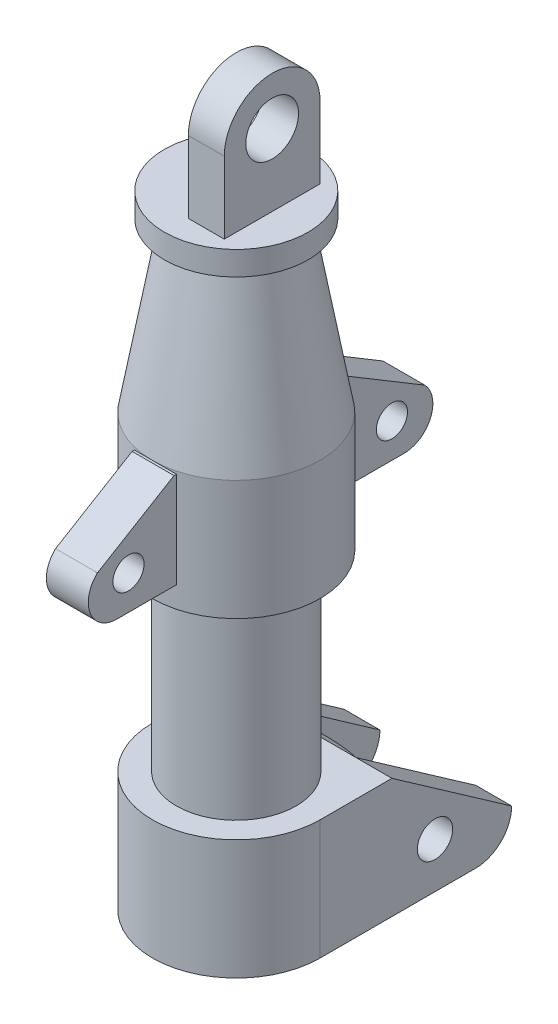
from build123d import *

# Parameters (mm, degrees)
SKETCH1_R                = 20
BOSS_EXTRUDE1_DEPTH      = 117.5
SKETCH2_R                = 35
BOSS_EXTRUDE2_DEPTH      = 50
SKETCH3_R                = 25
BOSS_EXTRUDE3_DEPTH      = 235
SKETCH1_3_R              = 20
CUT_EXTRUDE1_DEPTH       = 117.5
BOSS_EXTRUDE4_DEPTH      = 35
CUT_EXTRUDE2_DEPTH       = 80
BOSS_EXTRUDE5_START      = -50
BOSS_EXTRUDE5_DEPTH      = 50
BOSS_EXTRUDE6_START      = -50
BOSS_EXTRUDE6_DEPTH      = 50
CUT_EXTRUDE5_DEPTH       = 205.572725455
SKETCH12_R               = 7.371760232
CUT_EXTRUDE6_DEPTH       = 159.449518775
BOSS_EXTRUDE9_START      = -105
SKETCH16_R               = 35
BOSS_EXTRUDE9_DEPTH      = 105
CUT_EXTRUDE9_START       = -55
SKETCH18_R               = 35
CUT_EXTRUDE9_DEPTH       = 55
BOSS_EXTRUDE10_START     = 55
SKETCH19_R               = 25
BOSS_EXTRUDE10_DEPTH     = 55
SKETCH20_R               = 20
CUT_EXTRUDE10_DEPTH      = 251.699022734
SKETCH57_R               = 30
BOSS_EXTRUDE11_DEPTH     = 10
BOSS_EXTRUDE13_DEPTH     = 15
SKETCH59_R               = 11
CUT_EXTRUDE11_DEPTH      = 215.374088919
BOSS_EXTRUDE20_DEPTH     = 42.5
BOSS_EXTRUDE21_DEPTH     = 42.5
CUT_EXTRUDE12_DEPTH      = 25
CUT_EXTRUDE18_START      = -25
CUT_EXTRUDE18_DEPTH      = 25
SKETCH71_W               = 21.239894534
SKETCH71_H               = 33.551769162
CUT_EXTRUDE19_DEPTH      = 25
CUT_EXTRUDE20_DEPTH      = 214.26333487
CUT_EXTRUDE20_DEPTH_BACK = 214.26333487
SKETCH72_R               = 6.5


# Read off the part's stored shape, not the designer's step: Cut-Extrude18
with BuildPart() as part:
    # Sketch1 → Boss-Extrude1 (new, symmetric)
    with BuildSketch(Plane(origin=(0, 0, 0), x_dir=(1, 0, 0), z_dir=(0, 1, 0))):
        with Locations(Location((0, 0, 0), (0, 0, 90))):
            Circle(SKETCH1_R)
    extrude(amount=BOSS_EXTRUDE1_DEPTH, both=True)

    # Sketch2 → Boss-Extrude2 (add)
    with BuildSketch(Plane.XZ.offset(117.5)):
        with Locations(Location((0, 0, 0), (0, 0, 270))):
            Circle(SKETCH2_R)
    extrude(amount=-BOSS_EXTRUDE2_DEPTH)

    # Sketch3 → Boss-Extrude3 (add)
    with BuildSketch(Plane(origin=(0, 117.5, 0), x_dir=(1, 0, 0), z_dir=(0, 1, 0))):
        with Locations(Location((0, 0, 0), (0, 0, 270))):
            Circle(SKETCH3_R)
    extrude(amount=-BOSS_EXTRUDE3_DEPTH)

    # Sketch1<3> → Cut-Extrude1 (cut, symmetric)
    with BuildSketch(Plane(origin=(0, 0, 0), x_dir=(1, 0, 0), z_dir=(0, 1, 0))):
        with Locations(Location((0, 0, 0), (0, 0, 270))):
            Circle(SKETCH1_3_R)
    extrude(amount=CUT_EXTRUDE1_DEPTH, both=True, mode=Mode.SUBTRACT)

    # Sketch4 → Boss-Extrude4 (add, symmetric)
    with BuildSketch(Plane(origin=(0, 0, 0), x_dir=(0, 0, -1), z_dir=(1, 0, 0))):
        with BuildLine():
            Line((30.014819764, -67.5), (30.014819764, -117.5))
            Line((30.014819764, -117.5), (65, -117.5))
            ThreePointArc((65, -117.5), (75.606601718, -113.106601718), (80, -102.5))
            Line((80, -102.5), (30.014819764, -67.5))
        make_face()
    extrude(amount=BOSS_EXTRUDE4_DEPTH, both=True)

    # Sketch5 → Cut-Extrude2 (cut)
    with BuildSketch(Plane(origin=(35, 0, 0), x_dir=(0, 0, -1), z_dir=(1, 0, 0))):
        Polygon((30.014819764, -67.5), (35, -67.5), (35, -70.990660781), align=None)
    extrude(amount=-CUT_EXTRUDE2_DEPTH, mode=Mode.SUBTRACT)

    # Sketch6 → Boss-Extrude5 (add)
    with BuildSketch(Plane(origin=(0, -67.5, 0), x_dir=(1, 0, 0), z_dir=(0, 1, 0)).offset(BOSS_EXTRUDE5_START)):
        with BuildLine():
            Line((-35, 30.014819764), (-35, 0))
            ThreePointArc((-35, 0), (-30.455767215, 17.246629913), (-18.003071808, 30.014819764))
            Line((-18.003071808, 30.014819764), (-35, 30.014819764))
        make_face()
    extrude(amount=BOSS_EXTRUDE5_DEPTH)

    # Sketch7 → Boss-Extrude6 (add)
    with BuildSketch(Plane(origin=(0, -67.5, 0), x_dir=(1, 0, 0), z_dir=(0, 1, 0)).offset(BOSS_EXTRUDE6_START)):
        with BuildLine():
            Line((35, 30.014819764), (35, 0))
            ThreePointArc((35, 0), (30.455767215, 17.246629913), (18.003071808, 30.014819764))
            Line((18.003071808, 30.014819764), (35, 30.014819764))
        make_face()
    extrude(amount=BOSS_EXTRUDE6_DEPTH)

    # Sketch9 → Cut-Extrude5 (cut, through all)
    with BuildSketch(Plane(origin=(0, -67.5, 0), x_dir=(1, 0, 0), z_dir=(0, 1, 0))):
        with BuildLine():
            Line((0, 80), (-20, 80))
            Line((-20, 80), (-20, 30.014819764))
            ThreePointArc((-20, 30.014819764), (0, 35.08744218), (20, 30.014819764))
            Line((20, 30.014819764), (20, 80))
            Line((20, 80), (0, 80))
        make_face()
    extrude(amount=-CUT_EXTRUDE5_DEPTH, mode=Mode.SUBTRACT)

    # Sketch12 → Cut-Extrude6 (cut, through all)
    with BuildSketch(Plane(origin=(35, 0, 0), x_dir=(0, 0, -1), z_dir=(1, 0, 0))):
        with Locations((48, -98.5)):
            Circle(SKETCH12_R)
    extrude(amount=-CUT_EXTRUDE6_DEPTH, mode=Mode.SUBTRACT)

    # Sketch16 → Boss-Extrude9 (add)
    with BuildSketch(Plane(origin=(0, 117.5, 0), x_dir=(1, 0, 0), z_dir=(0, 1, 0)).offset(BOSS_EXTRUDE9_START)):
        with Locations(Location((0, 0, 0), (0, 0, 270))):
            Circle(SKETCH16_R)
    extrude(amount=BOSS_EXTRUDE9_DEPTH)

    # Sketch18 → Cut-Extrude9 (cut)
    with BuildSketch(Plane(origin=(0, 117.5, 0), x_dir=(1, 0, 0), z_dir=(0, 1, 0)).offset(CUT_EXTRUDE9_START)):
        with Locations(Location((0, 0, 0), (0, 0, 270))):
            Circle(SKETCH18_R)
    extrude(amount=CUT_EXTRUDE9_DEPTH, mode=Mode.SUBTRACT)

    # Sketch19 → Boss-Extrude10 (add)
    with BuildSketch(Plane(origin=(0, 62.5, 0), x_dir=(1, 0, 0), z_dir=(0, 1, 0)).offset(BOSS_EXTRUDE10_START)):
        with Locations(Location((0, 0, 0), (0, 0, 270))):
            Circle(SKETCH19_R)
    extrude(amount=-BOSS_EXTRUDE10_DEPTH)

    # Sketch20 → Cut-Extrude10 (cut, through all)
    with BuildSketch(Plane(origin=(0, 117.5, 0), x_dir=(1, 0, 0), z_dir=(0, 1, 0))):
        with Locations(Location((0, 0, 0), (0, 0, 270))):
            Circle(SKETCH20_R)
    extrude(amount=-CUT_EXTRUDE10_DEPTH, mode=Mode.SUBTRACT)

    # Sketch21 → Revolve1 (revolve)
    with BuildSketch(Plane(origin=(0, 0, 0), x_dir=(0, 0, -1), z_dir=(1, 0, 0))):
        Polygon((-35, 62.5), (-22.65711135, 132.5), (0, 132.5), (0, 62.5), align=None)
    revolve(axis=Axis((0, 132.5, 0), (0, -1, 0)))

    # Sketch57 → Boss-Extrude11 (add)
    with BuildSketch(Plane(origin=(0, 132.5, 0), x_dir=(1, 0, 0), z_dir=(0, 1, 0))):
        with Locations(Location((0, 0, 0), (0, 0, 270))):
            Circle(SKETCH57_R)
    extrude(amount=BOSS_EXTRUDE11_DEPTH)

    # Sketch58 → Boss-Extrude13 (add)
    with BuildSketch(Plane(origin=(0, 0, 0), x_dir=(0, 0, -1), z_dir=(1, 0, 0))):
        with BuildLine():
            Line((0, 142.5), (-20, 142.5))
            Line((-20, 142.5), (-20, 172.5))
            ThreePointArc((-20, 172.5), (0, 192.5), (20, 172.5))
            Line((20, 172.5), (20, 142.5))
            Line((20, 142.5), (0, 142.5))
        make_face()
    extrude(amount=BOSS_EXTRUDE13_DEPTH)

    # Sketch59 → Cut-Extrude11 (cut, through all)
    with BuildSketch(Plane(origin=(15, 0, 0), x_dir=(0, 0, -1), z_dir=(1, 0, 0))):
        with Locations((0, 172.5)):
            Circle(SKETCH59_R)
    extrude(amount=-CUT_EXTRUDE11_DEPTH, mode=Mode.SUBTRACT)


with BuildPart() as body_2:
    # Sketch61 → Boss-Extrude20 (new body)
    with BuildSketch(Plane(origin=(35, 0, 0), x_dir=(0, 0, -1), z_dir=(1, 0, 0))):
        with BuildLine():
            Line((-35, 22.5), (-60, 22.5))
            ThreePointArc((-60, 22.5), (-71.005339309, 30.215016925), (-67.94901172, 43.303097041))
            Line((-67.94901172, 43.303097041), (-36, 62.5))
            Line((-36, 62.5), (-35, 62.5))
            Line((-35, 62.5), (-35, 22.5))
        make_face()
    extrude(amount=-BOSS_EXTRUDE20_DEPTH)

    # Sketch66 → Cut-Extrude12 (cut)
    with BuildSketch(Plane(origin=(35, 0, 0), x_dir=(0, 0, -1), z_dir=(1, 0, 0))):
        with BuildLine():
            Line((-35, 22.5), (-60, 22.5))
            ThreePointArc((-60, 22.5), (-71.005339309, 30.215016925), (-67.94901172, 43.303097041))
            Line((-67.94901172, 43.303097041), (-36, 62.5))
            Line((-36, 62.5), (-35, 62.5))
            Line((-35, 62.5), (-35, 22.5))
        make_face()
    extrude(amount=-CUT_EXTRUDE12_DEPTH, mode=Mode.SUBTRACT)


with BuildPart() as body_3:
    # Sketch65 → Boss-Extrude21 (new body)
    with BuildSketch(Plane(origin=(35, 0, 0), x_dir=(0, 0, -1), z_dir=(1, 0, 0))):
        with BuildLine():
            Line((35, 22.5), (60, 22.5))
            ThreePointArc((60, 22.5), (71.127309171, 29.751326397), (68.754425185, 42.819155807))
            Line((68.754425185, 42.819155807), (36, 62.5))
            Line((36, 62.5), (35, 62.5))
            Line((35, 62.5), (35, 22.5))
        make_face()
    extrude(amount=-BOSS_EXTRUDE21_DEPTH)

    # Cut-Extrude18 outline → Cut-Extrude18 (cut)
    with BuildSketch(Plane(origin=(35, 0, 0), x_dir=(0, 0, -1), z_dir=(1, 0, 0)).offset(CUT_EXTRUDE18_START)):
        with BuildLine():
            ThreePointArc((60, 22.5), (71.062414441, 29.779286026), (68.754425185, 42.819155807))
            Line((68.754425185, 42.819155807), (36, 62.5))
            Line((36, 62.5), (35, 62.5))
            Line((35, 62.5), (35, 22.5))
            Line((35, 22.5), (60, 22.5))
        make_face()
    extrude(amount=CUT_EXTRUDE18_DEPTH, mode=Mode.SUBTRACT)

    # Sketch71 → Cut-Extrude19 (cut)
    with BuildSketch(Plane(origin=(10, 0, 0), x_dir=(0, 0, -1), z_dir=(1, 0, 0))):
        with Locations((67.690155939, 35.883693323)):
            Rectangle(SKETCH71_W, SKETCH71_H)
    extrude(amount=CUT_EXTRUDE19_DEPTH, mode=Mode.SUBTRACT)


with BuildPart() as cut_extrude20_tool:
    # Sketch72 → Cut-Extrude20 (new, two sides: drawn at the far end of the back side and taken through both)
    with BuildSketch(Plane(origin=(10, 0, 0), x_dir=(0, 0, -1), z_dir=(1, 0, 0)).offset(-CUT_EXTRUDE20_DEPTH_BACK)):
        with Locations((-55, 36.79)):
            Circle(SKETCH72_R)
        with Locations((55, 36.79)):
            Circle(SKETCH72_R)
    extrude(amount=CUT_EXTRUDE20_DEPTH + CUT_EXTRUDE20_DEPTH_BACK)


with BuildPart() as body_2_1:
    add(body_2.part)

    # Cut-Extrude20: cut by cut_extrude20_tool
    add(cut_extrude20_tool.part, mode=Mode.SUBTRACT)


with BuildPart() as body_3_1:
    add(body_3.part)

    # Cut-Extrude20: cut by cut_extrude20_tool
    add(cut_extrude20_tool.part, mode=Mode.SUBTRACT)


solid = Compound([part.part, body_2_1.part, body_3_1.part])
